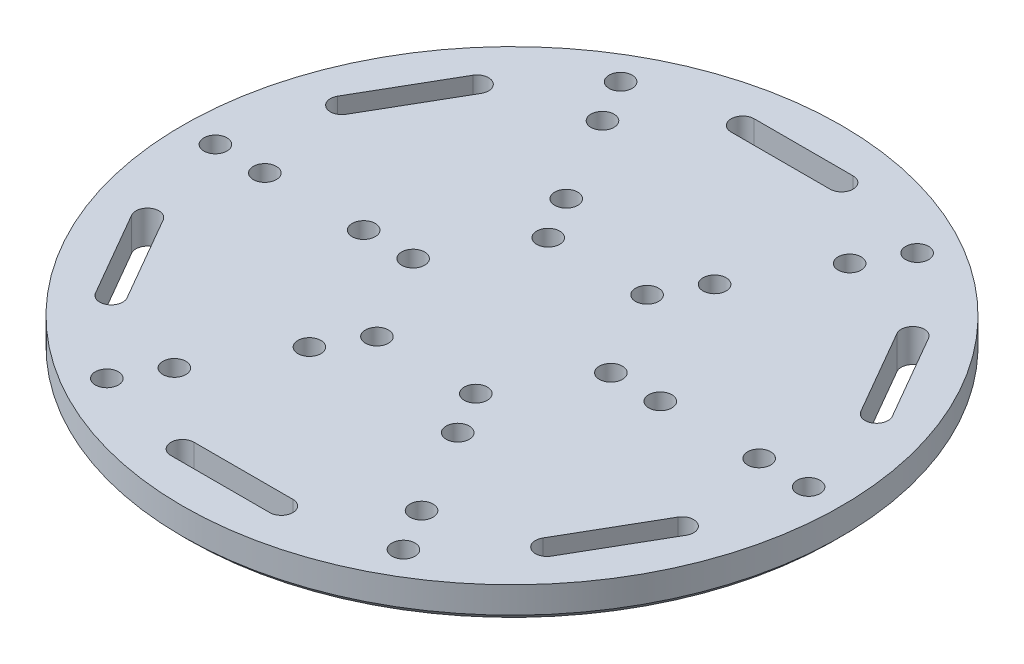
from build123d import *
from OCP.BRepFilletAPI import BRepFilletAPI_MakeFillet

# Parameters (mm, degrees)
EXTRUDE_1_DEPTH           = 5
SKETCH_3_R                = 2.4
CUT_EXTRUDE_1_DEPTH       = 8
PATTERN_CIRCULAR_1_COUNT  = 6
SKETCH_4_R                = 100
EXTRUDE_2_DEPTH           = 10
EXTRUDE_3_DEPTH           = 10
FILLET_2_R1               = 5
FILLET_2_R2               = 6
CHAMFER_4_SIZE            = 2
SKETCH_6_R                = 3.5
CUT_EXTRUDE_2_DEPTH       = 142.774468788
CHAMFER_1_SIZE            = 2
CHAMFER_1_SIZE_2          = 2.179882753
CUT_EXTRUDE_3_DEPTH       = 142.774468788
PATTERN_CIRCULAR_11_COUNT = 6
EXTRUDE_4_DEPTH           = 0.6
EXTRUDE_5_DEPTH           = 0.6
CHAMFER_2_SIZE            = 2
CHAMFER_3_SIZE            = 2


with BuildPart() as part:
    # 草圖1 → 填料-伸長1 (new, symmetric)
    with BuildSketch(Plane(origin=(0, 0, 0), x_dir=(1, 0, 0), z_dir=(0, 1, 0))):
        Polygon((58.791651246, 28.169872981), (53.791651246, 36.830127019), (5, 8.660254038), (5, 2.886751346), (10, 0), align=None)
        Polygon((5, 2.886751346), (5, 8.660254038), (0, 5.773502692), (2.5, 4.330127019), align=None)
        Polygon((0, 5.773502692), (5, 8.660254038), (5, 65), (-5, 65), (-5, 8.660254038), align=None)
        Polygon((2.5, 4.330127019), (0, 5.773502692), (-2.5, 4.330127019), (0, 0), align=None)
        Polygon((-2.5, 4.330127019), (0, 5.773502692), (-5, 8.660254038), (-5, 2.886751346), align=None)
        Polygon((10, 0), (5, 2.886751346), (5, 0), (5, -2.886751346), align=None)
        Polygon((5, 0), (5, 2.886751346), (2.5, 4.330127019), (0, 0), align=None)
        Polygon((58.791651246, -28.169872981), (10, 0), (5, -2.886751346), (5, -8.660254038), (53.791651246, -36.830127019), align=None)
        Polygon((0, 0), (-2.5, 4.330127019), (-5, 2.886751346), (-5, 0), align=None)
        Polygon((-5, 2.886751346), (-5, 8.660254038), (-53.791651246, 36.830127019), (-58.791651246, 28.169872981), (-10, 0), align=None)
        Polygon((5, -2.886751346), (5, 0), (0, 0), (2.5, -4.330127019), align=None)
        Polygon((5, -8.660254038), (5, -2.886751346), (2.5, -4.330127019), (0, -5.773502692), align=None)
        Polygon((-2.5, -4.330127019), (0, 0), (-5, 0), (-5, -2.886751346), align=None)
        Polygon((2.5, -4.330127019), (0, 0), (-2.5, -4.330127019), (0, -5.773502692), align=None)
        Polygon((-5, 0), (-5, 2.886751346), (-10, 0), (-5, -2.886751346), align=None)
        Polygon((5, -65), (5, -8.660254038), (0, -5.773502692), (-5, -8.660254038), (-5, -65), align=None)
        Polygon((0, -5.773502692), (-2.5, -4.330127019), (-5, -2.886751346), (-5, -8.660254038), align=None)
        Polygon((-5, -2.886751346), (-10, 0), (-58.791651246, -28.169872981), (-53.791651246, -36.830127019), (-5, -8.660254038), align=None)
    extrude(amount=EXTRUDE_1_DEPTH, both=True)

    # 草圖3 → 除料-伸長1 (cut)
    with BuildSketch(Plane.XY.offset(65)):
        Circle(SKETCH_3_R)
        with BuildLine():
            Line((-1.697056275, -1.697056275), (0, -3.39411255))
            Line((0, -3.39411255), (1.697056275, -1.697056275))
            ThreePointArc((1.697056275, -1.697056275), (0, -2.4), (-1.697056275, -1.697056275))
        make_face()
    cut_extrude_1 = extrude(amount=-CUT_EXTRUDE_1_DEPTH, mode=Mode.SUBTRACT)

    # 環狀複製排列1: 除料-伸長1 ×6 about axis
    pattern_circular_1_axis = Axis((0, 0, 0), (0, 1, 0))
    for i in range(1, PATTERN_CIRCULAR_1_COUNT):
        add(cut_extrude_1.rotate(pattern_circular_1_axis, i * 360 / PATTERN_CIRCULAR_1_COUNT), mode=Mode.SUBTRACT)

    # 草圖4 → 填料-伸長2 (add)
    with BuildSketch(Plane(origin=(0, 5, 0), x_dir=(1, 0, 0), z_dir=(0, 1, 0))):
        with Locations(Location((0, 0, 0), (0, 0, 270))):
            Circle(SKETCH_4_R)
    extrude(amount=EXTRUDE_2_DEPTH)

    # 草圖5 → 填料-伸長3 (add)
    with BuildSketch(Plane.XZ.offset(-5)):
        with BuildLine():
            ThreePointArc((56.887498564, -27.070509917), (61.452877921, -13.876015107), (63, 0))
            ThreePointArc((63, 0), (61.452877921, 13.876015107), (56.887498564, 27.070509917))
            Line((56.887498564, 27.070509917), (48.194638635, 22.051684898))
            ThreePointArc((48.194638635, 22.051684898), (51.784726743, 11.284594639), (53, 0))
            ThreePointArc((53, 0), (51.784726743, -11.284594639), (48.194638635, -22.051684898))
            Line((48.194638635, -22.051684898), (56.887498564, -27.070509917))
        make_face()
        with BuildLine():
            Line((43.194638635, 30.711938935), (51.887498564, 35.730763955))
            ThreePointArc((51.887498564, 35.730763955), (31.5, 54.559600438), (5, 62.801273872))
            Line((5, 62.801273872), (5, 52.763623833))
            ThreePointArc((5, 52.763623833), (26.5, 45.899346401), (43.194638635, 30.711938935))
        make_face()
        with BuildLine():
            ThreePointArc((5, -62.801273872), (31.5, -54.559600438), (51.887498564, -35.730763955))
            Line((51.887498564, -35.730763955), (43.194638635, -30.711938935))
            ThreePointArc((43.194638635, -30.711938935), (26.5, -45.899346401), (5, -52.763623833))
            Line((5, -52.763623833), (5, -62.801273872))
        make_face()
        with BuildLine():
            Line((-5, 52.763623833), (-5, 62.801273872))
            ThreePointArc((-5, 62.801273872), (-31.5, 54.559600438), (-51.887498564, 35.730763955))
            Line((-51.887498564, 35.730763955), (-43.194638635, 30.711938935))
            ThreePointArc((-43.194638635, 30.711938935), (-26.5, 45.899346401), (-5, 52.763623833))
        make_face()
        with BuildLine():
            ThreePointArc((-51.887498564, -35.730763955), (-31.5, -54.559600438), (-5, -62.801273872))
            Line((-5, -62.801273872), (-5, -52.763623833))
            ThreePointArc((-5, -52.763623833), (-26.5, -45.899346401), (-43.194638635, -30.711938935))
            Line((-43.194638635, -30.711938935), (-51.887498564, -35.730763955))
        make_face()
        with BuildLine():
            ThreePointArc((-56.887498564, 27.070509917), (-63, 0), (-56.887498564, -27.070509917))
            Line((-56.887498564, -27.070509917), (-48.194638635, -22.051684898))
            ThreePointArc((-48.194638635, -22.051684898), (-53, 0), (-48.194638635, 22.051684898))
            Line((-48.194638635, 22.051684898), (-56.887498564, 27.070509917))
        make_face()
    extrude(amount=EXTRUDE_3_DEPTH)

    # 圓角2: one fillet with a radius per group of edges: ONE call of the kernel's fillet builder (fillet() takes one radius for all edges)
    fillet_2_edges_1 = [part.edges().sort_by_distance(p)[0] for p in [
        (48.194638635, 0, 22.051684898),
        (48.194638635, 0, -22.051684898),
        (-48.194638635, 0, -22.051684898),
        (-48.194638635, 0, 22.051684898),
        (-43.194638635, 0, 30.711938935),
        (-5, 0, 52.763623833),
        (5, 0, 52.763623833),
        (43.194638635, 0, 30.711938935),
        (5, 0, -52.763623833),
        (43.194638635, 0, -30.711938935),
        (-43.194638635, 0, -30.711938935),
        (-5, 0, -52.763623833),
    ]]
    fillet_2_edges_2 = [part.edges().sort_by_distance(p)[0] for p in [
        (10, 0, 0),
        (5, 0, 8.660254038),
        (-5, 0, 8.660254038),
        (-10, 0, 0),
        (-5, 0, -8.660254038),
        (5, 0, -8.660254038),
    ]]
    fillet_2 = BRepFilletAPI_MakeFillet(part.part.solid().wrapped)
    for e in fillet_2_edges_1:
        fillet_2.Add(FILLET_2_R1, e.wrapped)
    for e in fillet_2_edges_2:
        fillet_2.Add(FILLET_2_R2, e.wrapped)
    add(Compound.cast(fillet_2.Shape()), mode=Mode.REPLACE)

    # 導角4
    chamfer_4_edges = [part.edges().sort_by_distance(p)[0] for p in [
        (26.07855135, 5, -20.829961334),
        (5, 5, -32.99966863),
        (26.5, 5, -45.899346401),
        (6.854235652, 5, -50.833186316),
        (40.595712879, 5, -31.352535356),
        (8, 5, -13.856406461),
        (-5, 5, -32.99966863),
        (-26.07855135, 5, -20.829961334),
        (-26.5, 5, -45.899346401),
        (-40.595712879, 5, -31.352535356),
        (-6.854235652, 5, -50.833186316),
        (-8, 5, -13.856406461),
        (-31.07855135, 5, -12.169707296),
        (-31.07855135, 5, 12.169707296),
        (-53, 5, 0),
        (-47.449948531, 5, -19.48065096),
        (-47.449948531, 5, 19.48065096),
        (-16, 5, 0),
        (-26.07855135, 5, 20.829961334),
        (-5, 5, 32.99966863),
        (-26.5, 5, 45.899346401),
        (-40.595712879, 5, 31.352535356),
        (-6.854235652, 5, 50.833186316),
        (-8, 5, 13.856406461),
        (26.07855135, 5, 20.829961334),
        (5, 5, 32.99966863),
        (26.5, 5, 45.899346401),
        (6.854235652, 5, 50.833186316),
        (40.595712879, 5, 31.352535356),
        (8, 5, 13.856406461),
        (31.07855135, 5, 12.169707296),
        (31.07855135, 5, -12.169707296),
        (53, 5, 0),
        (47.449948531, 5, 19.48065096),
        (47.449948531, 5, -19.48065096),
        (16, 5, 0),
    ]]
    chamfer(chamfer_4_edges, length=CHAMFER_4_SIZE)

    # 草圖6 → 除料-伸長2 (cut, through all)
    with BuildSketch(Plane.XZ.offset(-5)):
        with Locations(Location((30, 0, 0), (0, 0, 270))):
            Circle(SKETCH_6_R)
        with Locations(Location((45, 0, 0), (0, 0, 270))):
            Circle(SKETCH_6_R)
        with Locations(Location((75, 0, 0), (0, 0, 270))):
            Circle(SKETCH_6_R)
        with Locations(Location((90, 0, 0), (0, 0, 270))):
            Circle(SKETCH_6_R)
    cut_extrude_2 = extrude(amount=-CUT_EXTRUDE_2_DEPTH, mode=Mode.SUBTRACT)

    # 導角1
    # the kernel refuses this chamfer: 2.179882753, 2 mm, written as the material it adds along each edge
    with BuildSketch(Plane(origin=(56.887498564, 10.735971617, -27.070509917), x_dir=(0.413668279738856, 0, 0.9104276766102268), z_dir=(0, -1, 0)), Plane(origin=(51.887498564, 10.735971617, 35.730763955), x_dir=(-0.5816193563834205, 0, 0.8134610772988069), z_dir=(0, -1, 0)), Plane(origin=(5, 10.735971617, -62.801273872), x_dir=(0.9952876361223298, 0, 0.09696659931143743), z_dir=(0, -1, 0)), Plane(origin=(-5, 10.735971617, 62.801273872), x_dir=(-0.9952876361223234, 0, -0.0969665993115033), z_dir=(0, -1, 0)), Plane(origin=(-51.887498564, 10.735971617, -35.730763955), x_dir=(0.58161935638343, 0, -0.8134610772988004), z_dir=(0, -1, 0)), Plane(origin=(-56.887498564, 10.735971617, 27.070509917), x_dir=(-0.4136682797388463, 0, -0.9104276766102312), z_dir=(0, -1, 0))) as chamfer_1_piece_1:
        with BuildLine():
            Line((2.226375558, 0), (-CHAMFER_1_SIZE * 0.0969665993113, -CHAMFER_1_SIZE * 0.995287636122))
            Line((-CHAMFER_1_SIZE * 0.0969665993113, -CHAMFER_1_SIZE * 0.995287636122), (0, 0))
            ThreePointArc((0, 0), (1.146880074, -0.009826576), (2.226375558, 0))
        make_face()
    extrude(amount=15.735971617)
    with BuildSketch(Plane(origin=(56.887498564, 10.617375534, 27.070509917), x_dir=(0.8660254037845192, 0, 0.4999999999998602), z_dir=(0, -1, 0)), Plane(origin=(5, 10.617375534, 62.801273872), x_dir=(0, 0, 1), z_dir=(0, -1, 0)), Plane(origin=(51.887498564, 10.617375534, -35.730763955), x_dir=(0.8660254037846294, 0, -0.49999999999966954), z_dir=(0, -1, 0)), Plane(origin=(-51.887498564, 10.617375534, 35.730763955), x_dir=(-0.8660254037846367, 0, 0.49999999999965694), z_dir=(0, -1, 0)), Plane(origin=(-5, 10.617375534, -62.801273872), x_dir=(0, 0, -1), z_dir=(0, -1, 0)), Plane(origin=(-56.887498564, 10.617375534, -27.070509917), x_dir=(-0.8660254037845148, 0, -0.4999999999998682), z_dir=(0, -1, 0))) as chamfer_1_piece_2:
        with BuildLine():
            Line((CHAMFER_1_SIZE_2, 0), (-0.194034741, -2.023788749))
            ThreePointArc((-0.194034741, -2.023788749), (-0.091852046, -1.043874104), (0, 0))
            Line((0, 0), (CHAMFER_1_SIZE_2, 0))
        make_face()
    extrude(amount=15.617375534)
    # the kernel refuses this chamfer: 2.179882753, 2 mm, written as the material it adds along each edge
    with BuildSketch(Plane(origin=(0, 5, 0), x_dir=(0.8821168953677567, 0, -0.47103055411167355), z_dir=(-0.47103055411167355, 0, -0.8821168953677567))) as chamfer_1_2_piece_1:
        Polygon((63, CHAMFER_1_SIZE), (63 + CHAMFER_1_SIZE, 0), (63, 0), align=None)
    revolve(axis=Axis((0, 5, 0), (0, -1, 0)), revolution_arc=56.378254611)
    with BuildSketch(Plane(origin=(0, 5, 0), x_dir=(0.8489828735032396, 0, 0.5284203634401141), z_dir=(0.5284203634401141, 0, -0.8489828735032396))) as chamfer_1_2_piece_2:
        Polygon((63, CHAMFER_1_SIZE), (63 + CHAMFER_1_SIZE, 0), (63, 0), align=None)
    revolve(axis=Axis((0, 5, 0), (0, -1, 0)), revolution_arc=56.378254611)
    with BuildSketch(Plane(origin=(0, 5, 0), x_dir=(0.03313402186452938, 0, -0.999450917551773), z_dir=(-0.999450917551773, 0, -0.03313402186452938))) as chamfer_1_2_piece_3:
        Polygon((63, CHAMFER_1_SIZE), (63 + CHAMFER_1_SIZE, 0), (63, 0), align=None)
    revolve(axis=Axis((0, 5, 0), (0, -1, 0)), revolution_arc=56.378254611)
    with BuildSketch(Plane(origin=(0, 5, 0), x_dir=(-0.03313402186451921, 0, 0.9994509175517734), z_dir=(0.9994509175517734, 0, 0.03313402186451921))) as chamfer_1_2_piece_4:
        Polygon((63, CHAMFER_1_SIZE), (63 + CHAMFER_1_SIZE, 0), (63, 0), align=None)
    revolve(axis=Axis((0, 5, 0), (0, -1, 0)), revolution_arc=56.378254611)
    with BuildSketch(Plane(origin=(0, 5, 0), x_dir=(-0.8489828735032365, 0, -0.528420363440119), z_dir=(-0.528420363440119, 0, 0.8489828735032365))) as chamfer_1_2_piece_5:
        Polygon((63, CHAMFER_1_SIZE), (63 + CHAMFER_1_SIZE, 0), (63, 0), align=None)
    revolve(axis=Axis((0, 5, 0), (0, -1, 0)), revolution_arc=56.378254611)
    with BuildSketch(Plane(origin=(0, 5, 0), x_dir=(-0.8821168953677601, 0, 0.4710305541116675), z_dir=(0.4710305541116675, 0, 0.8821168953677601))) as chamfer_1_2_piece_6:
        Polygon((63, CHAMFER_1_SIZE), (63 + CHAMFER_1_SIZE, 0), (63, 0), align=None)
    revolve(axis=Axis((0, 5, 0), (0, -1, 0)), revolution_arc=56.378254611)

    # 草圖8 → 除料-伸長3 (cut, through all)
    with BuildSketch(Plane.XZ.offset(-5)):
        with BuildLine():
            Line((-15, 88.5), (15, 88.5))
            ThreePointArc((15, 88.5), (18.5, 85), (15, 81.5))
            Line((15, 81.5), (-15, 81.5))
            ThreePointArc((-15, 81.5), (-18.5, 85), (-15, 88.5))
        make_face()
    cut_extrude_3 = extrude(amount=-CUT_EXTRUDE_3_DEPTH, mode=Mode.SUBTRACT)

    # 環狀複製排列11: 除料-伸長2, 除料-伸長3 ×6 about axis
    pattern_circular_11_axis = Axis((0, 0, 0), (0, 1, 0))
    add([cut_extrude_2.rotate(pattern_circular_11_axis, i * 360 / PATTERN_CIRCULAR_11_COUNT) for i in range(1, PATTERN_CIRCULAR_11_COUNT)], mode=Mode.SUBTRACT)
    add([cut_extrude_3.rotate(pattern_circular_11_axis, i * 360 / PATTERN_CIRCULAR_11_COUNT) for i in range(1, PATTERN_CIRCULAR_11_COUNT)], mode=Mode.SUBTRACT)

    # 草圖9 → 填料-伸長4 (add)
    with BuildSketch(Plane.XZ.offset(5)):
        with BuildLine():
            add(Edge.make_bspline(
                [(-7.807500598, 3.418478261), (-7.648583205, 3.269043367), (-7.307132536, 2.947966841), (-6.704402109, 2.490089307), (-5.99946891, 1.996610087), (-5.182084817, 1.476825409), (-4.257365102, 0.92837273), (-3.221912373, 0.354992356), (-2.08232336, -0.257441217), (-1.276140447, -0.656412262), (-0.856413642, -0.864130435)],
                knots=[0, 0, 0, 0, 0.638779608, 1.372484911, 2.214797435, 3.160111188, 4.209727821, 5.364596358, 6.627917397, 8, 8, 8, 8], degree=3))
            add(Edge.make_bspline(
                [(-0.856413642, -0.864130435), (-0.626416723, -0.978403751), (-0.196896656, -1.191809576), (0.404267833, -1.487859328), (0.907426473, -1.75509236), (1.212514131, -1.920132446), (1.350108097, -1.994565217)],
                knots=[0, 0, 0, 0, 1.242963083, 2.321237996, 3.242881461, 4, 4, 4, 4], degree=3))
            add(Edge.make_bspline(
                [(1.350108097, -1.994565217), (1.758541606, -2.210931945), (2.57315811, -2.642473196), (3.746153927, -3.371905755), (4.884275029, -4.14839709), (5.970191457, -4.972366093), (6.984250928, -5.815486344), (7.881121753, -6.67926128), (8.675514821, -7.526975846), (9.123144707, -8.124559369), (9.339238532, -8.413043478)],
                knots=[0, 0, 0, 0, 1.073257855, 2.140601943, 3.206161346, 4.272410075, 5.305729299, 6.2669797, 7.163382524, 8, 8, 8, 8], degree=3))
            add(Edge.make_bspline(
                [(9.339238532, -8.413043478), (9.502558168, -8.222254684), (9.834917649, -7.83399479), (10.267519131, -7.184629275), (10.647516443, -6.470806272), (10.987960368, -5.700099096), (11.259473131, -4.861214502), (11.453066025, -3.958224975), (11.575822747, -2.994319814), (11.588279124, -2.330094856), (11.594673315, -1.989130435)],
                knots=[0, 0, 0, 0, 0.864644388, 1.759572627, 2.68107051, 3.648109727, 4.658639956, 5.712659029, 6.825846753, 8, 8, 8, 8], degree=3))
            add(Edge.make_bspline(
                [(11.594673315, -1.989130435), (11.579497966, -1.569753922), (11.549261036, -0.734144869), (11.322122997, 0.502074106), (10.9338572, 1.701628973), (10.49741359, 2.669173597), (10.072089114, 3.418081377), (9.714633729, 3.967770999), (9.31414511, 4.49397457), (8.886632543, 5.009310494), (8.410078667, 5.496987457), (7.900463852, 5.968639951), (7.354276366, 6.424642679), (6.965992438, 6.705192652), (6.768586358, 6.847826087)],
                knots=[0, 0, 0, 0, 1.440386654, 2.869975047, 4.300971821, 5.763351605, 6.507558049, 7.258500937, 8.01409797, 8.77833563, 9.557432766, 10.354617705, 11.163476916, 12, 12, 12, 12], degree=3))
            add(Edge.make_bspline(
                [(6.768586358, 6.847826087), (6.528195876, 7.014597436), (6.050254818, 7.346169945), (5.294690904, 7.775295912), (4.528748665, 8.174392055), (3.744290353, 8.501268739), (2.981068507, 8.780598187), (2.255383988, 8.975549556), (1.583140584, 9.107123031), (1.149557964, 9.122900303), (0.942499402, 9.130434783)],
                knots=[0, 0, 0, 0, 1.106892818, 2.200709116, 3.286348403, 4.374043109, 5.41513044, 6.35996767, 7.216798089, 8, 8, 8, 8], degree=3))
            add(Edge.make_bspline(
                [(0.942499402, 9.130434783), (0.744379396, 9.12239127), (0.367311666, 9.107082625), (-0.162507905, 8.984785683), (-0.616134687, 8.769905271), (-0.984157571, 8.471795209), (-1.270859384, 8.113829277), (-1.472297223, 7.709146296), (-1.605561508, 7.267370458), (-1.616909532, 6.957512889), (-1.62271799, 6.798913043)],
                knots=[0, 0, 0, 0, 1.215101314, 2.312615987, 3.312106868, 4.268820462, 5.194274158, 6.104170638, 7.029624333, 8, 8, 8, 8], degree=3))
            add(Edge.make_bspline(
                [(-1.62271799, 6.798913043), (-1.613863484, 6.584565449), (-1.596081973, 6.154115222), (-1.466577522, 5.516439639), (-1.257501366, 4.891021726), (-0.966879962, 4.277125081), (-0.586982433, 3.678470562), (-0.127348672, 3.089726515), (0.414582462, 2.513380902), (1.02566812, 1.955912015), (1.69011425, 1.440247376), (2.389497508, 0.98812747), (3.105056801, 0.599033223), (3.847120068, 0.288200785), (4.606742669, 0.042005937), (5.387790309, -0.129029755), (6.187158385, -0.245947284), (6.728304476, -0.255853921), (7.00228201, -0.260869565)],
                knots=[0, 0, 0, 0, 0.842731029, 1.692362182, 2.548600718, 3.431493157, 4.356729828, 5.331638863, 6.365121243, 7.464656374, 8.58205491, 9.669074467, 10.737057578, 11.781219009, 12.829045155, 13.873182274, 14.92321078, 16, 16, 16, 16], degree=3))
            add(Edge.make_bspline(
                [(7.00228201, -0.260869565), (7.034908146, -0.25930524), (7.107513459, -0.255824033), (7.216105837, -0.245084542), (7.313796065, -0.234642527), (7.371840355, -0.230000123), (7.393586358, -0.22826087)],
                knots=[0, 0, 0, 0, 0.997940782, 2.220790257, 3.333427962, 4, 4, 4, 4], degree=3))
            add(Edge.make_bspline(
                [(7.393586358, -0.22826087), (7.530998416, -0.238182245), (7.796015758, -0.257316931), (8.09926421, -0.392634029), (8.288948441, -0.548761228), (8.396885678, -0.6899949), (8.449967966, -0.862570491), (8.459357555, -0.981602186), (8.464238532, -1.043478261)],
                knots=[0, 0, 0, 0, 1.641076606, 3.165033465, 3.873174418, 4.571616644, 5.257485541, 6, 6, 6, 6], degree=3))
            add(Edge.make_bspline(
                [(8.464238532, -1.043478261), (8.459767084, -1.150529153), (8.451350661, -1.352026689), (8.397903381, -1.63360496), (8.284720826, -1.865087583), (8.094857777, -2.09456367), (7.807087021, -2.297704592), (7.545132801, -2.331690168), (7.420760271, -2.347826087)],
                knots=[0, 0, 0, 0, 1.032248688, 1.942959691, 2.739252078, 3.483527131, 4.80521071, 6, 6, 6, 6], degree=3))
            add(Edge.make_bspline(
                [(7.420760271, -2.347826087), (7.088808392, -2.339377822), (6.43160072, -2.322651708), (5.459177905, -2.191726508), (4.509065171, -1.990548255), (3.590182764, -1.684691507), (2.692549268, -1.3118445), (1.827042826, -0.845501764), (0.985516208, -0.298403823), (0.180406991, 0.323261707), (-0.56103168, 1.005529831), (-1.220038466, 1.723070581), (-1.774601467, 2.479211416), (-2.226111696, 3.267053009), (-2.580517784, 4.087084466), (-2.828836217, 4.939532901), (-2.988023509, 5.823769337), (-3.00530672, 6.425047129), (-3.014022338, 6.72826087)],
                knots=[0, 0, 0, 0, 1.042835586, 2.064635238, 3.078585738, 4.090392272, 5.103335354, 6.129771482, 7.175137039, 8.254669859, 9.322383694, 10.337995048, 11.311584762, 12.262761458, 13.185977341, 14.11191004, 15.047869675, 16, 16, 16, 16], degree=3))
            add(Edge.make_bspline(
                [(-3.014022338, 6.72826087), (-3.007914869, 6.92045274), (-2.995889444, 7.298872898), (-2.927222131, 7.856798058), (-2.799148018, 8.388549555), (-2.633879492, 8.899227642), (-2.407018345, 9.38035353), (-2.133128854, 9.836971461), (-1.818835243, 10.276745403), (-1.449559953, 10.678323131), (-1.048517083, 11.04845155), (-0.621696153, 11.373780789), (-0.170545026, 11.649883504), (0.303786365, 11.87255117), (0.800948679, 12.046939724), (1.319383757, 12.173660447), (1.860924072, 12.242862606), (2.228549939, 12.254803095), (2.415325489, 12.260869565)],
                knots=[0, 0, 0, 0, 1.066764962, 2.100428934, 3.112356169, 4.097822877, 5.073757988, 6.056452055, 7.04978342, 8.067486315, 9.077764442, 10.075004876, 11.040477382, 12.007309635, 12.977011994, 13.95960322, 14.963358499, 16, 16, 16, 16], degree=3))
            add(Edge.make_bspline(
                [(2.415325489, 12.260869565), (2.698638994, 12.249994699), (3.264185694, 12.228286434), (4.101345974, 12.065593871), (4.919237867, 11.79679478), (5.716839675, 11.414634734), (6.506875491, 10.932205255), (7.280903204, 10.334625951), (8.053059943, 9.636148421), (8.535523999, 9.10927611), (8.784890706, 8.836956522)],
                knots=[0, 0, 0, 0, 0.9107558, 1.81803877, 2.731882833, 3.672722676, 4.655956658, 5.703542789, 6.813051531, 8, 8, 8, 8], degree=3))
            add(Edge.make_bspline(
                [(8.784890706, 8.836956522), (9.103610385, 8.451049453), (9.738632624, 7.682161976), (10.56271438, 6.434177672), (11.283041819, 5.127537542), (11.886014176, 3.769820407), (12.37801259, 2.392635053), (12.727098204, 1.011750689), (12.942877229, -0.359124925), (12.971697164, -1.270989963), (12.985977662, -1.722826087)],
                knots=[0, 0, 0, 0, 1.03536233, 2.062872631, 3.089944948, 4.120577319, 5.134567748, 6.113134407, 7.065043619, 8, 8, 8, 8], degree=3))
            add(Edge.make_bspline(
                [(12.985977662, -1.722826087), (12.976849298, -2.13990279), (12.95900939, -2.955011519), (12.812209935, -4.143922372), (12.559728988, -5.265584437), (12.221033018, -6.314101641), (11.803360205, -7.278206254), (11.297638702, -8.129308214), (10.738250304, -8.886409463), (10.288208491, -9.298099401), (10.067499402, -9.5)],
                knots=[0, 0, 0, 0, 1.169577678, 2.285749758, 3.353304316, 4.389738571, 5.372572775, 6.292822968, 7.162767817, 8, 8, 8, 8], degree=3))
            add(Edge.make_bspline(
                [(10.067499402, -9.5), (10.229054912, -9.679171594), (10.564931347, -10.051672142), (10.86246687, -10.608974335), (11.050704023, -11.062462877), (11.16460063, -11.359092467), (11.22895303, -11.613263501), (11.241320604, -11.767868925), (11.246847228, -11.836956522)],
                knots=[0, 0, 0, 0, 1.627360266, 3.383307463, 4.234677826, 4.951976713, 5.531676127, 6, 6, 6, 6], degree=3))
            add(Edge.make_bspline(
                [(11.246847228, -11.836956522), (11.231790144, -11.92116038), (11.200813944, -12.094388855), (11.095005743, -12.340177521), (10.952795132, -12.571202907), (10.822242845, -12.694496415), (10.757716793, -12.755434783)],
                knots=[0, 0, 0, 0, 0.962817872, 1.980758078, 3.001980647, 4, 4, 4, 4], degree=3))
            add(Edge.make_bspline(
                [(10.757716793, -12.755434783), (10.699212471, -12.739716914), (10.557665238, -12.701688599), (10.376140254, -12.499210117), (10.189697816, -12.20104315), (10.008250458, -11.807968129), (9.825395799, -11.39127303), (9.630660276, -11.016645263), (9.443081735, -10.70678523), (9.304679088, -10.535033103), (9.241412445, -10.456521739)],
                knots=[0, 0, 0, 0, 0.509010389, 1.231516064, 2.227301181, 3.535320422, 4.913321666, 6.1176414, 7.139535894, 8, 8, 8, 8], degree=3))
            add(Edge.make_bspline(
                [(9.241412445, -10.456521739), (8.993574821, -10.673468601), (8.507707584, -11.098776795), (7.721253073, -11.642771959), (6.916268347, -12.109365868), (6.081911782, -12.485247232), (5.2207222, -12.775559161), (4.331182351, -12.983549611), (3.407725154, -13.103309946), (2.781606624, -13.121310586), (2.464238532, -13.130434783)],
                knots=[0, 0, 0, 0, 1.058333428, 2.07478401, 3.068958327, 4.046630322, 5.011867857, 5.986811613, 6.979551433, 8, 8, 8, 8], degree=3))
            add(Edge.make_bspline(
                [(2.464238532, -13.130434783), (2.059745446, -13.117679228), (1.241981631, -13.09189132), (0.009595763, -12.91918442), (-1.232065963, -12.626254847), (-2.477817498, -12.231535367), (-3.705729101, -11.731492267), (-4.887754841, -11.116514489), (-6.027469498, -10.412989087), (-6.734313807, -9.863530634), (-7.090109294, -9.586956522)],
                knots=[0, 0, 0, 0, 0.935085025, 1.890461727, 2.870811517, 3.88143221, 4.908827087, 5.931559099, 6.95883446, 8, 8, 8, 8], degree=3))
            add(Edge.make_bspline(
                [(-7.090109294, -9.586956522), (-7.373568846, -9.348974788), (-7.940269999, -8.873194305), (-8.678513001, -8.039705441), (-9.357016887, -7.145828807), (-9.935369009, -6.175187835), (-10.416867379, -5.160779658), (-10.76108732, -4.118998601), (-10.970371663, -3.064511933), (-10.999499438, -2.357797506), (-11.014022338, -2.005434783)],
                knots=[0, 0, 0, 0, 1.006685902, 2.012597765, 3.023999696, 4.059646995, 5.083760482, 6.076028927, 7.04072188, 8, 8, 8, 8], degree=3))
            add(Edge.make_bspline(
                [(-11.014022338, -2.005434783), (-10.998675786, -1.609549263), (-10.968103921, -0.82090573), (-10.780600432, 0.15187013), (-10.559619116, 0.913882986), (-10.33893895, 1.47636733), (-10.085010765, 2.035632858), (-9.882688136, 2.394516376), (-9.780326685, 2.576086957)],
                knots=[0, 0, 0, 0, 1.483706415, 2.955691516, 3.699283832, 4.456096877, 5.218890327, 6, 6, 6, 6], degree=3))
            add(Edge.make_bspline(
                [(-9.780326685, 2.576086957), (-9.873537867, 2.754176214), (-10.064303273, 3.118652544), (-10.305710446, 3.700804722), (-10.520099598, 4.324774791), (-10.753125711, 5.209373286), (-10.966588109, 6.349077419), (-10.998283925, 7.274287049), (-11.014022338, 7.733695652)],
                knots=[0, 0, 0, 0, 0.675429286, 1.382329235, 2.116079239, 2.891626604, 4.456551432, 6, 6, 6, 6], degree=3))
            add(Edge.make_bspline(
                [(-11.014022338, 7.733695652), (-11.007904351, 8.080059996), (-10.996235815, 8.740663721), (-10.877253327, 9.678889727), (-10.681648832, 10.513083278), (-10.461513927, 11.140565648), (-10.227714151, 11.569500802), (-10.054392224, 11.852421718), (-9.847417326, 12.079535325), (-9.636472147, 12.277794129), (-9.399161177, 12.421377193), (-9.15171219, 12.537607498), (-8.882464396, 12.59433776), (-8.698995877, 12.603880285), (-8.606413642, 12.608695652)],
                knots=[0, 0, 0, 0, 2.084961299, 3.976544432, 5.680538487, 7.240750148, 7.958158152, 8.620811422, 9.231406585, 9.803047661, 10.356926303, 10.894117681, 11.441947545, 12, 12, 12, 12], degree=3))
            add(Edge.make_bspline(
                [(-8.606413642, 12.608695652), (-8.44271747, 12.597632256), (-8.121658563, 12.575933509), (-7.67850635, 12.356494724), (-7.303469841, 12.011260775), (-7.012723257, 11.536252893), (-6.774202371, 10.970107334), (-6.612967218, 10.313297654), (-6.506688249, 9.57955643), (-6.497237499, 9.063832239), (-6.492283207, 8.793478261)],
                knots=[0, 0, 0, 0, 0.807862871, 1.584469374, 2.399562144, 3.310308402, 4.326146776, 5.441070629, 6.65855287, 8, 8, 8, 8], degree=3))
            add(Edge.make_bspline(
                [(-6.492283207, 8.793478261), (-6.494524415, 8.603073253), (-6.499081847, 8.215890186), (-6.566887493, 7.625146169), (-6.654963456, 7.010885923), (-6.794330049, 6.370832166), (-6.97799715, 5.697517653), (-7.197826064, 4.976583821), (-7.485724944, 4.213374909), (-7.697688132, 3.689752859), (-7.807500598, 3.418478261)],
                knots=[0, 0, 0, 0, 0.819908147, 1.667259458, 2.55920234, 3.493056846, 4.487081967, 5.565959708, 6.738988737, 8, 8, 8, 8], degree=3))
        make_face()
        with BuildLine():
            add(Edge.make_bspline(
                [(-8.845544077, 4.364130435), (-8.732405915, 4.727474064), (-8.495680848, 5.487717506), (-8.239374405, 6.464632294), (-8.060374201, 7.279893542), (-7.951598698, 7.888065383), (-7.900152109, 8.480991612), (-7.889033377, 8.869497193), (-7.883587555, 9.059782609)],
                knots=[0, 0, 0, 0, 1.423562709, 2.978596914, 3.776176252, 4.54606507, 5.287879952, 6, 6, 6, 6], degree=3))
            add(Edge.make_bspline(
                [(-7.883587555, 9.059782609), (-7.886285703, 9.182935953), (-7.89129275, 9.411475879), (-7.911287239, 9.725731707), (-7.968252969, 9.979943792), (-8.034207317, 10.184181057), (-8.134987196, 10.338798889), (-8.266276999, 10.4498816), (-8.431575735, 10.509422007), (-8.549813577, 10.517500602), (-8.611848425, 10.52173913)],
                knots=[0, 0, 0, 0, 1.604809214, 2.978100039, 4.088582266, 4.991494519, 5.756986983, 6.460742378, 7.19241073, 8, 8, 8, 8], degree=3))
            add(Edge.make_bspline(
                [(-8.611848425, 10.52173913), (-8.679274048, 10.51280029), (-8.82385883, 10.493632201), (-9.013037883, 10.334853705), (-9.186062415, 10.106956131), (-9.339250778, 9.794228243), (-9.468945815, 9.407588204), (-9.555000531, 8.948574115), (-9.618354133, 8.423851612), (-9.621205996, 8.050959714), (-9.62271799, 7.85326087)],
                knots=[0, 0, 0, 0, 0.525553034, 1.126974677, 1.868166685, 2.779566103, 3.847635091, 5.068993124, 6.446046495, 8, 8, 8, 8], degree=3))
            add(Edge.make_bspline(
                [(-9.62271799, 7.85326087), (-9.62040369, 7.677338018), (-9.615858803, 7.33185567), (-9.556170496, 6.827916108), (-9.48093297, 6.346464207), (-9.318193465, 5.76300986), (-9.097362852, 5.107508403), (-8.925316706, 4.59962207), (-8.845544077, 4.364130435)],
                knots=[0, 0, 0, 0, 0.879955159, 1.728081218, 2.537518329, 3.316098459, 4.75555548, 6, 6, 6, 6], degree=3))
        make_face(mode=Mode.SUBTRACT)
        with BuildLine():
            add(Edge.make_bspline(
                [(-8.74771799, 0.293478261), (-8.81305327, 0.059779661), (-8.938974421, -0.39062932), (-9.119156342, -1.041871541), (-9.254369713, -1.664818283), (-9.268130231, -2.075414344), (-9.274891903, -2.277173913)],
                knots=[0, 0, 0, 0, 1.105790344, 2.131197627, 3.081703902, 4, 4, 4, 4], degree=3))
            add(Edge.make_bspline(
                [(-9.274891903, -2.277173913), (-9.26667743, -2.525952232), (-9.250314394, -3.021512801), (-9.113250896, -3.756544653), (-8.89612639, -4.477187316), (-8.587728131, -5.181820683), (-8.196866707, -5.868936591), (-7.709727966, -6.527100005), (-7.153047487, -7.174315555), (-6.723123594, -7.565933028), (-6.503152772, -7.766304348)],
                knots=[0, 0, 0, 0, 0.940442188, 1.873338757, 2.81853779, 3.782261528, 4.776754077, 5.80205394, 6.875419557, 8, 8, 8, 8], degree=3))
            add(Edge.make_bspline(
                [(-6.503152772, -7.766304348), (-6.221998514, -8.001432652), (-5.644422148, -8.484457711), (-4.656827763, -9.09388236), (-3.566991062, -9.652985678), (-2.386251697, -10.135663283), (-1.160342341, -10.534218484), (0.06468384, -10.822724687), (1.2666561, -11.00664529), (2.061443504, -11.031313752), (2.453368967, -11.043478261)],
                knots=[0, 0, 0, 0, 0.904108197, 1.857313245, 2.857737599, 3.926987559, 5.003652493, 6.037809272, 7.032404761, 8, 8, 8, 8], degree=3))
            add(Edge.make_bspline(
                [(2.453368967, -11.043478261), (2.736169644, -11.036415824), (3.292234574, -11.022529105), (4.112519322, -10.936559673), (4.902216432, -10.782574563), (5.906517805, -10.506539026), (7.089214841, -10.074323536), (7.988796927, -9.651324385), (8.426195054, -9.445652174)],
                knots=[0, 0, 0, 0, 0.815719989, 1.603932787, 2.375570413, 3.133553764, 4.606265919, 6, 6, 6, 6], degree=3))
            add(Edge.make_bspline(
                [(8.426195054, -9.445652174), (8.307445413, -9.384112014), (8.038660552, -9.244818427), (7.569659584, -9.057630703), (7.003336714, -8.838459139), (6.333460204, -8.599035383), (5.558710558, -8.346710195), (4.681108718, -8.075475988), (3.702833244, -7.781906202), (3.015141195, -7.582727455), (2.654455923, -7.47826087)],
                knots=[0, 0, 0, 0, 0.525478959, 1.189399717, 1.982900282, 2.913171394, 3.985103244, 5.185641672, 6.523906742, 8, 8, 8, 8], degree=3))
            add(Edge.make_bspline(
                [(2.654455923, -7.47826087), (2.262899418, -7.363155069), (1.522232563, -7.145421358), (0.480332069, -6.825337112), (-0.432323757, -6.533798368), (-0.992688705, -6.336344189), (-1.253152772, -6.244565217)],
                knots=[0, 0, 0, 0, 1.194987865, 2.260434678, 3.191430047, 4, 4, 4, 4], degree=3))
            add(Edge.make_bspline(
                [(-1.253152772, -6.244565217), (-1.658586414, -6.083405144), (-2.461852247, -5.764106579), (-3.603549815, -5.158869331), (-4.674382263, -4.461386987), (-5.679573337, -3.681234718), (-6.591442384, -2.803268743), (-7.415277361, -1.849481861), (-8.147010464, -0.819751852), (-8.546849375, -0.078771096), (-8.74771799, 0.293478261)],
                knots=[0, 0, 0, 0, 1.027666934, 2.036066202, 3.039136508, 4.036730618, 5.030232177, 6.017115258, 7.003850553, 8, 8, 8, 8], degree=3))
        make_face(mode=Mode.SUBTRACT)
    extrude(amount=EXTRUDE_4_DEPTH)

    # 草圖10 → 填料-伸長5 (add)
    with BuildSketch(Plane.XZ.offset(5)):
        with BuildLine():
            Line((1, -20), (1, -60))
            ThreePointArc((1, -60), (0, -61), (-1, -60))
            Line((-1, -60), (-1, -20))
            ThreePointArc((-1, -20), (0, -19), (1, -20))
        make_face()
        with BuildLine():
            Line((1, 20), (1, 60))
            ThreePointArc((1, 60), (0, 61), (-1, 60))
            Line((-1, 60), (-1, 20))
            ThreePointArc((-1, 20), (0, 19), (1, 20))
        make_face()
    extrude(amount=EXTRUDE_5_DEPTH)

    # 導角2
    # the kernel refuses this chamfer: 2 mm, written as the material it takes off along each edge
    with BuildSketch(Plane(origin=(61.363334234, -5, -23.715587385), x_dir=(-0.8660254037844403, 0, 0.4999999999999973), z_dir=(-0.49999999999999734, 0, -0.8660254037844403)), Plane(origin=(51.219968258, -5, 41.284412615), x_dir=(-0.8660254037844362, 0, -0.5000000000000044), z_dir=(0.5000000000000044, 0, -0.8660254037844362)), Plane(origin=(-10.143365976, -5, 65), x_dir=(0, 0, -1), z_dir=(1, 0, 0)), Plane(origin=(-61.363334234, -5, 23.715587385), x_dir=(0.8660254037844434, 0, -0.499999999999992), z_dir=(0.499999999999992, 0, 0.8660254037844433)), Plane(origin=(-51.219968258, -5, -41.284412615), x_dir=(0.8660254037844326, 0, 0.5000000000000104), z_dir=(-0.5000000000000104, 0, 0.8660254037844326)), Plane(origin=(10.143365976, -5, -65), x_dir=(0, 0, 1), z_dir=(-1, 0, 0))) as chamfer_2_piece_1:
        Polygon((CHAMFER_2_SIZE, 0), (0, CHAMFER_2_SIZE), (0, 0), align=None)
    extrude(amount=20.286731952, mode=Mode.SUBTRACT)
    with BuildSketch(Plane(origin=(0, -5, 0), x_dir=(-0.8489828735032259, 0, -0.5284203634401361), z_dir=(-0.5284203634401361, 0, 0.8489828735032259))) as chamfer_2_piece_2_section:
        Polygon((63 - CHAMFER_2_SIZE, 0), (63, -CHAMFER_2_SIZE), (63, 0), align=None)
    chamfer_2_piece_2 = revolve(axis=Axis((0, -5, 0), (0, -1, 0)), revolution_arc=56.378254611, mode=Mode.PRIVATE)
    chamfer_2_piece_2 = split(chamfer_2_piece_2, bisect_by=Plane(origin=(-34.976847632, -5, -29.81811747), z_dir=(-0.7609958814384511, 0, -0.6487567097408048)), keep=Keep.TOP, mode=Mode.PRIVATE)
    chamfer_2_piece_2 = split(chamfer_2_piece_2, bisect_by=Plane(origin=(-12.774519727, -5, -47.675156663), z_dir=(-0.25881904510230663, 0, -0.9659258262891257)), keep=Keep.TOP, mode=Mode.PRIVATE)
    add(chamfer_2_piece_2, mode=Mode.SUBTRACT)
    with BuildSketch(Plane(origin=(0, -5, 0), x_dir=(0.03313402186452554, 0, -0.9994509175517732), z_dir=(-0.9994509175517732, 0, -0.03313402186452554))) as chamfer_2_piece_3_section:
        Polygon((63 - CHAMFER_2_SIZE, 0), (63, -CHAMFER_2_SIZE), (63, 0), align=None)
    chamfer_2_piece_3 = revolve(axis=Axis((0, -5, 0), (0, -1, 0)), revolution_arc=56.378254611, mode=Mode.PRIVATE)
    chamfer_2_piece_3 = split(chamfer_2_piece_3, bisect_by=Plane(origin=(8.334823406, -5, -45.199897329), z_dir=(0.18134185079175058, 0, -0.983420120371463)), keep=Keep.TOP, mode=Mode.PRIVATE)
    chamfer_2_piece_3 = split(chamfer_2_piece_3, bisect_by=Plane(origin=(34.900636936, -5, -34.900636936), z_dir=(0.7071067811869148, 0, -0.7071067811861803)), keep=Keep.TOP, mode=Mode.PRIVATE)
    add(chamfer_2_piece_3, mode=Mode.SUBTRACT)
    with BuildSketch(Plane(origin=(0, -5, 0), x_dir=(0.8806672484416841, 0, 0.473735366551995), z_dir=(-0.473735366551995, 0, 0.8806672484416841))) as chamfer_2_piece_4_section:
        Polygon((63 - CHAMFER_2_SIZE, 0), (63, CHAMFER_2_SIZE), (63, 0), align=None)
    chamfer_2_piece_4 = revolve(axis=Axis((0, -5, 0), (0, 1, 0)), revolution_arc=56.378254611, mode=Mode.PRIVATE)
    chamfer_2_piece_4 = split(chamfer_2_piece_4, bisect_by=Plane(origin=(43.311671038, -5, -15.381779859), z_dir=(0.942337732230276, 0, -0.33466341063089156)), keep=Keep.TOP, mode=Mode.PRIVATE)
    chamfer_2_piece_4 = split(chamfer_2_piece_4, bisect_by=Plane(origin=(47.675156663, -5, 12.774519727), z_dir=(0.9659258262888828, 0, 0.2588190451032133)), keep=Keep.TOP, mode=Mode.PRIVATE)
    add(chamfer_2_piece_4, mode=Mode.SUBTRACT)
    with BuildSketch(Plane(origin=(0, -5, 0), x_dir=(0.8489828735032322, 0, 0.528420363440126), z_dir=(0.528420363440126, 0, -0.8489828735032322))) as chamfer_2_piece_5_section:
        Polygon((63 - CHAMFER_2_SIZE, 0), (63, -CHAMFER_2_SIZE), (63, 0), align=None)
    chamfer_2_piece_5 = revolve(axis=Axis((0, -5, 0), (0, -1, 0)), revolution_arc=56.378254611, mode=Mode.PRIVATE)
    chamfer_2_piece_5 = split(chamfer_2_piece_5, bisect_by=Plane(origin=(34.976847632, -5, 29.81811747), z_dir=(0.7609958814387443, 0, 0.6487567097404611)), keep=Keep.TOP, mode=Mode.PRIVATE)
    chamfer_2_piece_5 = split(chamfer_2_piece_5, bisect_by=Plane(origin=(12.774519727, -5, 47.675156663), z_dir=(0.25881904510222825, 0, 0.9659258262891467)), keep=Keep.TOP, mode=Mode.PRIVATE)
    add(chamfer_2_piece_5, mode=Mode.SUBTRACT)
    with BuildSketch(Plane(origin=(0, -5, 0), x_dir=(-0.03313402186450823, 0, 0.9994509175517737), z_dir=(0.9994509175517737, 0, 0.03313402186450823))) as chamfer_2_piece_6_section:
        Polygon((63 - CHAMFER_2_SIZE, 0), (63, -CHAMFER_2_SIZE), (63, 0), align=None)
    chamfer_2_piece_6 = revolve(axis=Axis((0, -5, 0), (0, -1, 0)), revolution_arc=56.378254611, mode=Mode.PRIVATE)
    chamfer_2_piece_6 = split(chamfer_2_piece_6, bisect_by=Plane(origin=(-8.334823406, -5, 45.199897329), z_dir=(-0.18134185079175058, 0, 0.983420120371463)), keep=Keep.TOP, mode=Mode.PRIVATE)
    chamfer_2_piece_6 = split(chamfer_2_piece_6, bisect_by=Plane(origin=(-34.900636936, -5, 34.900636936), z_dir=(-0.7071067811877333, 0, 0.7071067811853617)), keep=Keep.TOP, mode=Mode.PRIVATE)
    add(chamfer_2_piece_6, mode=Mode.SUBTRACT)
    with BuildSketch(Plane(origin=(0, -5, 0), x_dir=(-0.8821168953677653, 0, 0.4710305541116575), z_dir=(0.4710305541116575, 0, 0.8821168953677653))) as chamfer_2_piece_7_section:
        Polygon((63, -CHAMFER_2_SIZE), (63 - CHAMFER_2_SIZE, 0), (63, 0), align=None)
    chamfer_2_piece_7 = revolve(axis=Axis((0, -5, 0), (0, -1, 0)), revolution_arc=56.378254611, mode=Mode.PRIVATE)
    chamfer_2_piece_7 = split(chamfer_2_piece_7, bisect_by=Plane(origin=(-47.675156663, -5, -12.774519727), z_dir=(-0.9659258262888828, 0, -0.2588190451032133)), keep=Keep.TOP, mode=Mode.PRIVATE)
    chamfer_2_piece_7 = split(chamfer_2_piece_7, bisect_by=Plane(origin=(-43.311671038, -5, 15.381779859), z_dir=(-0.942337732230276, 0, 0.33466341063089156)), keep=Keep.TOP, mode=Mode.PRIVATE)
    add(chamfer_2_piece_7, mode=Mode.SUBTRACT)

    # 導角3
    chamfer_3_edges = [part.edges().sort_by_distance(p)[0] for p in [
        (0, 5, -100),
    ]]
    chamfer(chamfer_3_edges, length=CHAMFER_3_SIZE)


solid = part.part
